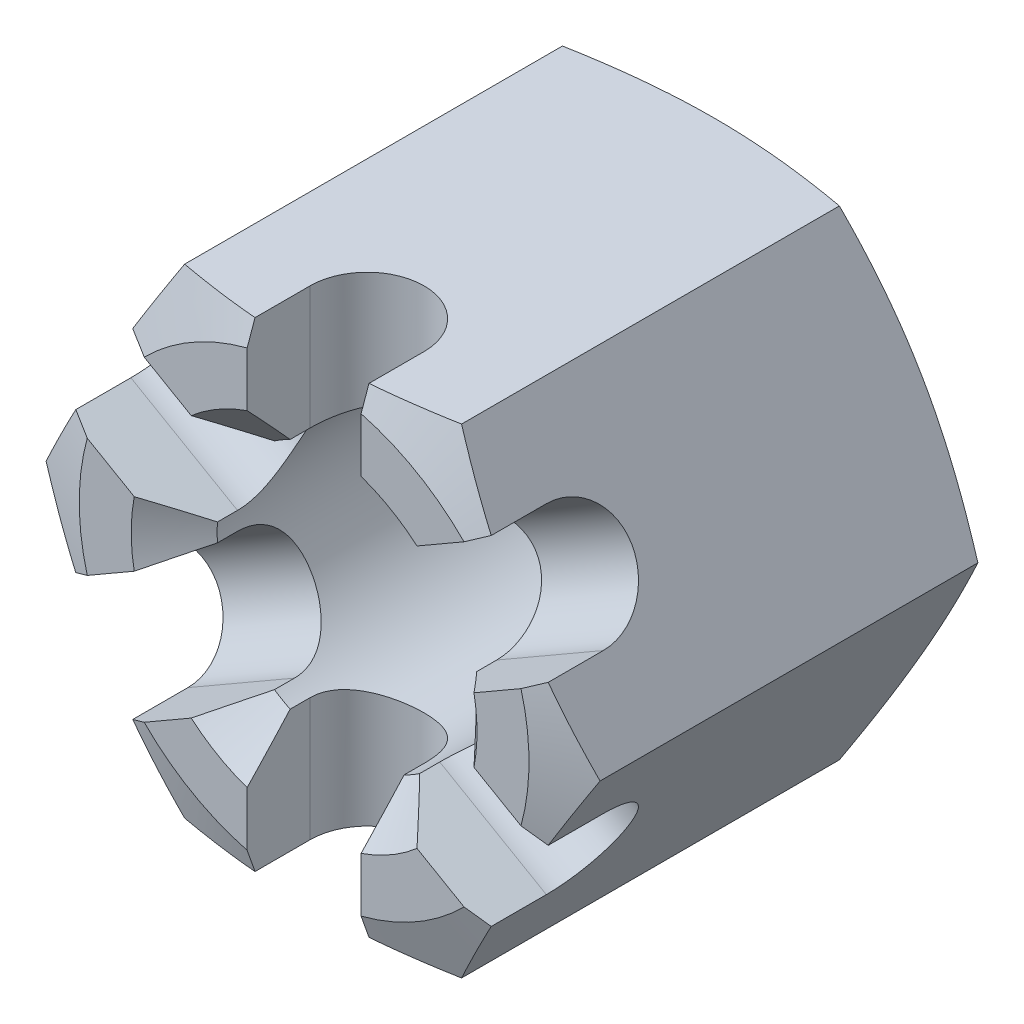
from build123d import *

# Parameters (mm, degrees)
BASENUT_DEPTH     = 20.8
SKETCH3_R         = 6.5
HOLE_DEPTH        = 31.825873676
SLOT_DEPTH        = 39.248765601
SLOTPATTERN_COUNT = 6


with BuildPart() as part:
    # Sketch1 → BaseNut (new body)
    with BuildSketch(Plane.XY):
        Polygon((6.92820323, -12), (13.856406461, 0), (6.92820323, 12), (-6.92820323, 12), (-13.856406461, 0), (-6.92820323, -12), align=None)
    extrude(amount=-BASENUT_DEPTH)

    # Sketch2 → Double-Chamfer (revolve, cut)
    with BuildSketch(Plane(origin=(-3.47179677, 0, -17.32820323), x_dir=(0, 0, -1), z_dir=(0, 1, 0))):
        Polygon((3.47179677, 7.77820323), (2.5231424, 10.384609691), (3.47179677, 10.384609691), align=None)
        Polygon((-17.32820323, 7.77820323), (-17.32820323, 10.384609691), (-16.37954886, 10.384609691), align=None)
    revolve(axis=Axis((0, 0, -17.32820323), (0, 0, 1)), mode=Mode.SUBTRACT)

    # Sketch3 → Hole (cut, through all)
    with BuildSketch(Plane(origin=(-4.279914938, -1.735659213, -20.8), x_dir=(-1, 0, 0), z_dir=(0, 0, -1))):
        with Locations((-4.279914938, 1.735659213)):
            Circle(SKETCH3_R)
    extrude(amount=-HOLE_DEPTH, mode=Mode.SUBTRACT)

    # Sketch4 → EndChamfer (revolve, cut)
    with BuildSketch(Plane(origin=(-15.758283222, 0, -7.108283222), x_dir=(0, 0, -1), z_dir=(0, 1, 0))):
        Polygon((13.691716778, -24.408283222), (11.541716778, -22.258283222), (13.691716778, -22.258283222), align=None)
        Polygon((-7.108283222, -22.258283222), (-4.958283222, -22.258283222), (-7.108283222, -24.408283222), align=None)
    revolve(axis=Axis((0, 0, -7.108283222), (0, 0, 1)), mode=Mode.SUBTRACT)

    # Sketch5 → Slot (cut, through all)
    with BuildSketch(Plane(origin=(-17.8, 0, -17.8), x_dir=(0, 0, -1), z_dir=(0, 1, 0))):
        with BuildLine():
            Line((-17.8, -14.95), (-14.65, -14.95))
            ThreePointArc((-14.65, -14.95), (-11.8, -17.8), (-14.65, -20.65))
            Line((-14.65, -20.65), (-17.8, -20.65))
            Line((-17.8, -20.65), (-17.8, -14.95))
        make_face()
    slot = extrude(amount=-SLOT_DEPTH, mode=Mode.SUBTRACT)

    # SlotPattern: Slot ×6 about axis
    slotpattern_axis = Axis((0, 0, -7.108283222), (0, 0, 1))
    for i in range(1, SLOTPATTERN_COUNT):
        add(slot.rotate(slotpattern_axis, i * 360 / SLOTPATTERN_COUNT), mode=Mode.SUBTRACT)


solid = part.part
